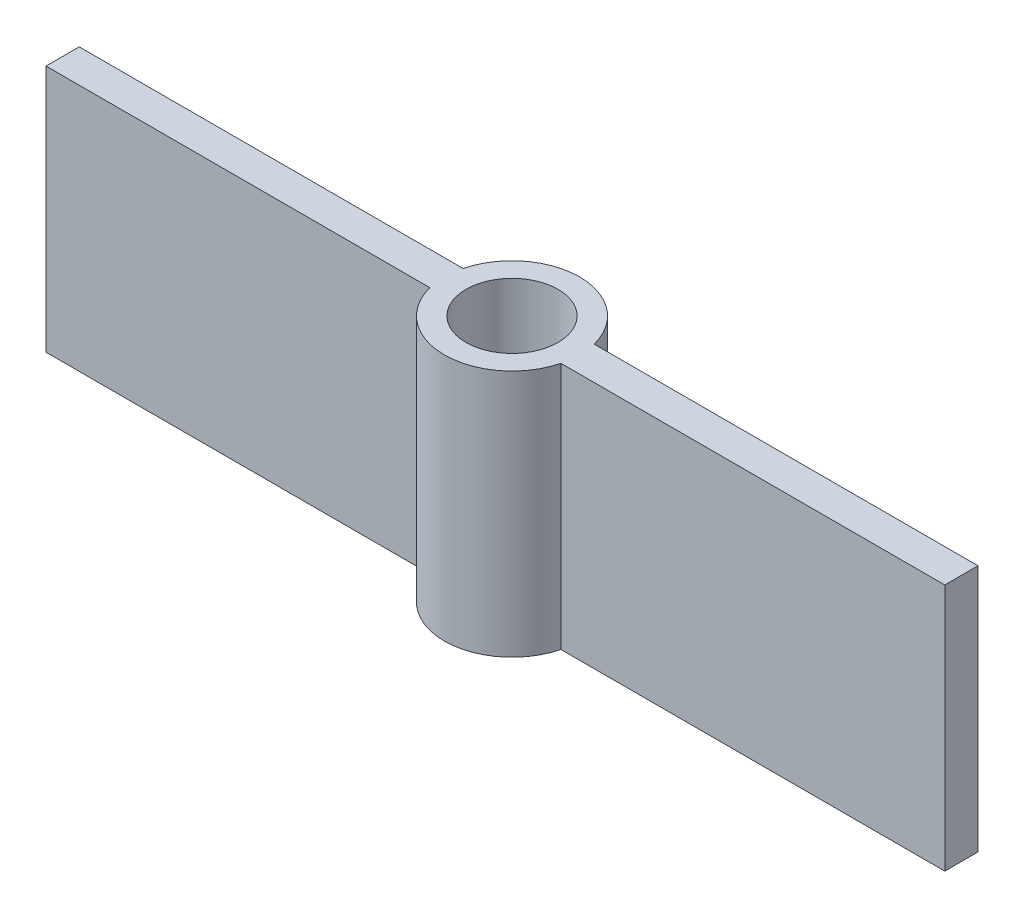
from build123d import *

# Parameters (mm, degrees)
BOSS_EXTRUDE2_DEPTH      = 23
BOSS_EXTRUDE2_DEPTH_BACK = 0.0001
SKETCH2_R                = 6.272360189
SKETCH2_W                = 83.401872842
SKETCH2_H                = 3.0835427
SHELL3_START             = -0.0001
SHELL3_OUTLINE_R         = 4.272360189
SHELL3_DEPTH             = 23.0001


# Read off the part's stored shape, not the designer's step: Shell3
with BuildPart() as part:
    # Sketch2 → Boss-Extrude2 (new, two sides: drawn at the far end of the back side and taken through both)
    with BuildSketch(Plane(origin=(0, 0, 0), x_dir=(1, 0, 0), z_dir=(0, 1, 0)).offset(-BOSS_EXTRUDE2_DEPTH_BACK)):
        with Locations((2.638515629, 0)):
            Circle(SKETCH2_R)
        with Locations((2.638515629, 0)):
            Rectangle(SKETCH2_W, SKETCH2_H)
    extrude(amount=BOSS_EXTRUDE2_DEPTH + BOSS_EXTRUDE2_DEPTH_BACK)

    # Shell3 outline → Shell3 (cut)
    with BuildSketch(Plane(origin=(0, 0, 0), x_dir=(1, 0, 0), z_dir=(0, 1, 0)).offset(SHELL3_START)):
        with Locations((2.638515629, 0)):
            Circle(SHELL3_OUTLINE_R)
    extrude(amount=SHELL3_DEPTH, mode=Mode.SUBTRACT)


solid = part.part
